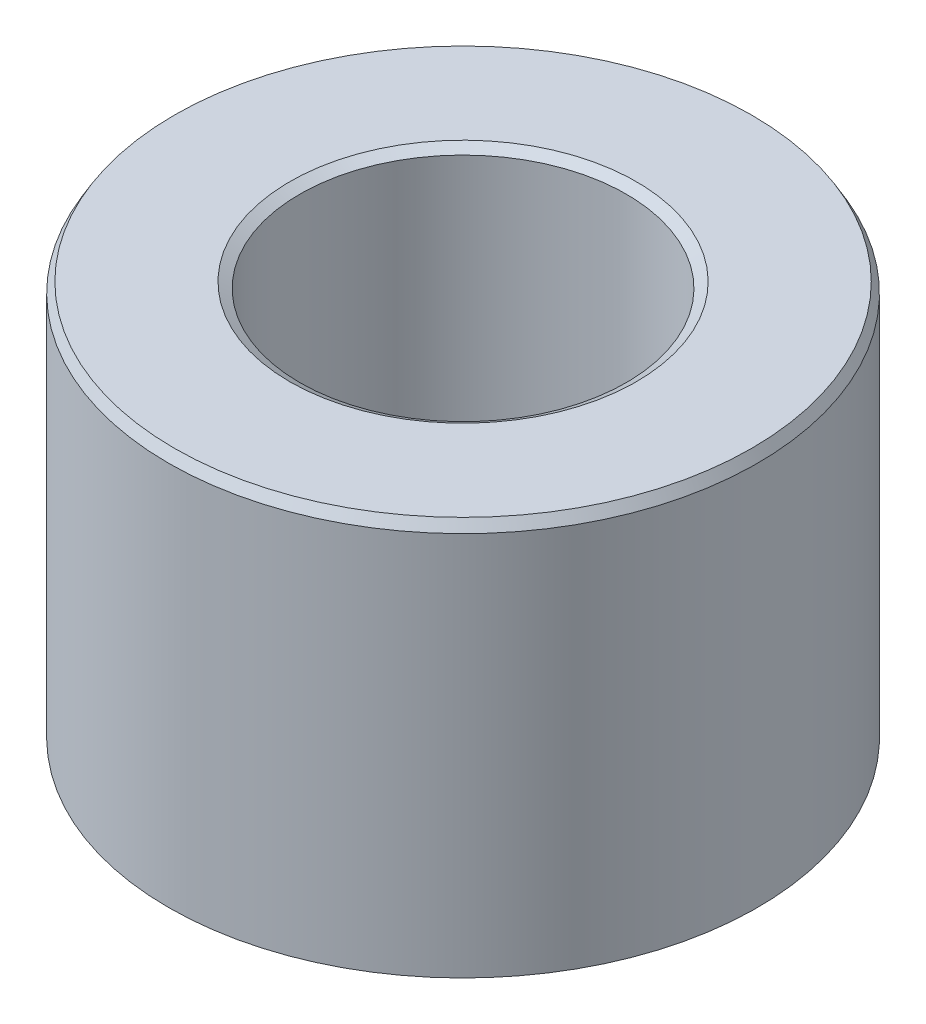
from build123d import *
from OCP.BRepFilletAPI import BRepFilletAPI_MakeChamfer

# Parameters (mm, degrees)
SKETCH1_R           = 50
BOSS_EXTRUDE1_DEPTH = 68.029805521
SKETCH2_R           = 27.727798328
CUT_EXTRUDE1_DEPTH  = 99.122649981
CHAMFER1_SIZE       = 1.703236459
CHAMFER1_SIZE2      = 0.983364028


with BuildPart() as part:
    # Sketch1 → Boss-Extrude1 (new body)
    with BuildSketch(Plane(origin=(0, 0, 0), x_dir=(1, 0, 0), z_dir=(0, 1, 0))):
        Circle(SKETCH1_R)
    extrude(amount=BOSS_EXTRUDE1_DEPTH)

    # Sketch2 → Cut-Extrude1 (cut, through all)
    with BuildSketch(Plane(origin=(0, 0, 0), x_dir=(1, 0, 0), z_dir=(0, 1, 0))):
        Circle(SKETCH2_R)
    extrude(amount=CUT_EXTRUDE1_DEPTH, mode=Mode.SUBTRACT)

    # Chamfer1: one chamfer whose edges measure the first distance from different faces: ONE call of the kernel's chamfer builder (chamfer() names one face for all edges)
    chamfer1_edges_1 = [part.edges().sort_by_distance(p)[0] for p in [
        (-27.727798328, 68.029805521, 0),
    ]]
    chamfer1_side_1 = [part.faces().sort_by_distance(p)[0] for p in [
        (-48.585786438, 68.029805521, 0),
    ]]
    chamfer1_edges_2 = [part.edges().sort_by_distance(p)[0] for p in [
        (-27.727798328, 0, 0),
    ]]
    chamfer1_side_2 = [part.faces().sort_by_distance(p)[0] for p in [
        (-27.727798328, 34.014902761, 0),
    ]]
    chamfer1_edges_3 = [part.edges().sort_by_distance(p)[0] for p in [
        (-50, 0, 0),
    ]]
    chamfer1_side_3 = [part.faces().sort_by_distance(p)[0] for p in [
        (-48.585786438, 0, 0),
    ]]
    chamfer1_edges_4 = [part.edges().sort_by_distance(p)[0] for p in [
        (-50, 68.029805521, 0),
    ]]
    chamfer1_side_4 = [part.faces().sort_by_distance(p)[0] for p in [
        (-50, 34.014902761, 0),
    ]]
    chamfer1 = BRepFilletAPI_MakeChamfer(part.part.solid().wrapped)
    for e in chamfer1_edges_1:
        chamfer1.Add(CHAMFER1_SIZE, CHAMFER1_SIZE2, e.wrapped, chamfer1_side_1[0].wrapped)  # the first distance lies on this face
    for e in chamfer1_edges_2:
        chamfer1.Add(CHAMFER1_SIZE, CHAMFER1_SIZE2, e.wrapped, chamfer1_side_2[0].wrapped)  # the first distance lies on this face
    for e in chamfer1_edges_3:
        chamfer1.Add(CHAMFER1_SIZE, CHAMFER1_SIZE2, e.wrapped, chamfer1_side_3[0].wrapped)  # the first distance lies on this face
    for e in chamfer1_edges_4:
        chamfer1.Add(CHAMFER1_SIZE, CHAMFER1_SIZE2, e.wrapped, chamfer1_side_4[0].wrapped)  # the first distance lies on this face
    add(Compound.cast(chamfer1.Shape()), mode=Mode.REPLACE)


solid = part.part
